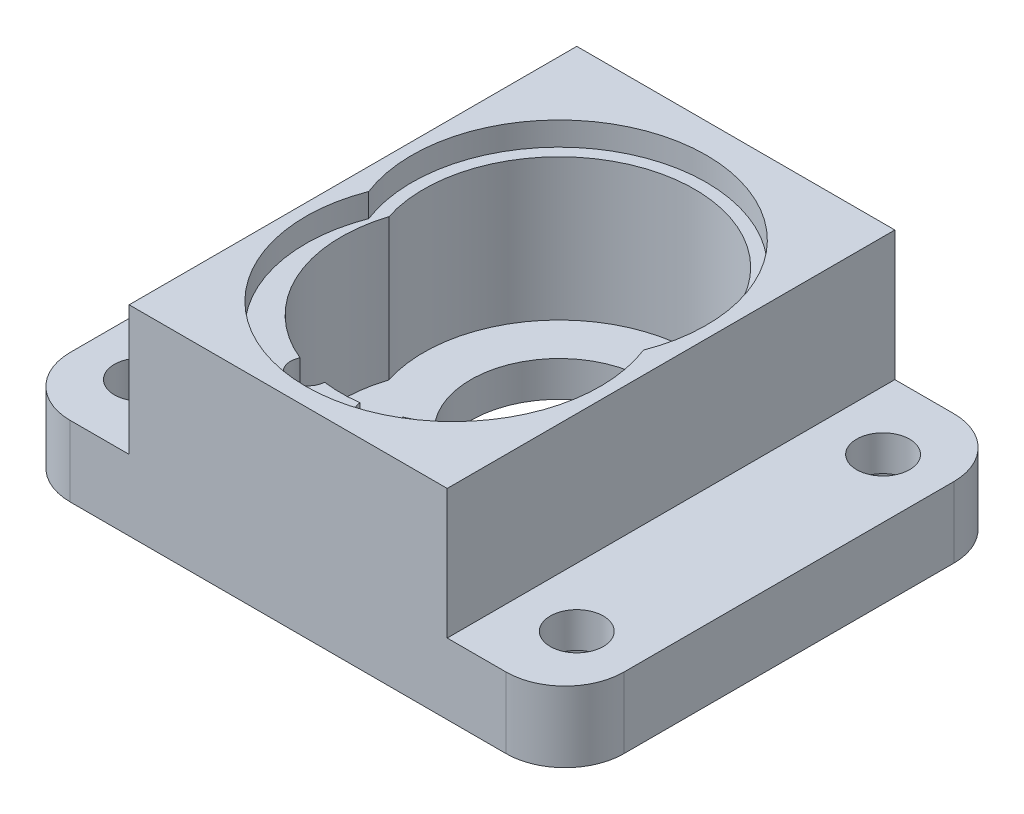
from build123d import *

# Parameters (mm, degrees)
SKETCH_1_W          = 27
SKETCH_1_H          = 38
SKETCH_1_R          = 7.5
SKETCH_1_R_2        = 3.5
SKETCH_1_R_3        = 1.5
EXTRUDE_1_DEPTH     = 3
SKETCH_4_W          = 10
SKETCH_4_H          = 6
EXTRUDE_3_DEPTH     = 38
SKETCH_6_R          = 2.5
CUT_EXTRUDE_3_DEPTH = 1
EXTRUDE_4_OUTLINE_W = 27
EXTRUDE_4_OUTLINE_H = 38
EXTRUDE_4_DEPTH     = 14
SKETCH_13_R         = 2.25
CUT_EXTRUDE_6_DEPTH = 10
CUT_EXTRUDE_8_DEPTH = 2
FILLET_1_R          = 5
SKETCH_17_R         = 4
CUT_EXTRUDE_9_DEPTH = 3


# Read off the part's stored shape, not the designer's step: 凸台-拉伸4
with BuildPart() as part:
    # 草图1 → 凸台-拉伸1 (new body)
    with BuildSketch(Plane(origin=(0, 0, 0), x_dir=(1, 0, 0), z_dir=(0, 1, 0))):
        with Locations((0, 4.3)):
            Rectangle(SKETCH_1_W, SKETCH_1_H)
        with Locations(Location((0, 8.3, 0), (0, 0, 270))):
            Circle(SKETCH_1_R, mode=Mode.SUBTRACT)
        with Locations(Location((0, -5.5, 0), (0, 0, 270))):
            Circle(SKETCH_1_R_2, mode=Mode.SUBTRACT)
        with Locations(Location((-9.5, 0, 0), (0, 0, 90))):
            Circle(SKETCH_1_R_3, mode=Mode.SUBTRACT)
        with Locations(Location((-3, -10, 0), (0, 0, 90))):
            Circle(SKETCH_1_R_3, mode=Mode.SUBTRACT)
        with Locations(Location((9.5, 0, 0), (0, 0, 270))):
            Circle(SKETCH_1_R_3, mode=Mode.SUBTRACT)
        with Locations(Location((3, -10, 0), (0, 0, 270))):
            Circle(SKETCH_1_R_3, mode=Mode.SUBTRACT)
    extrude(amount=EXTRUDE_1_DEPTH)

    # 草图4 → 凸台-拉伸3 (add)
    with BuildSketch(Plane(origin=(0, 0, -23.3), x_dir=(-1, 0, 0), z_dir=(0, 0, -1))):
        with Locations((-18.5, 3)):
            Rectangle(SKETCH_4_W, SKETCH_4_H)
        with Locations((18.5, 3)):
            Rectangle(SKETCH_4_W, SKETCH_4_H)
    extrude(amount=-EXTRUDE_3_DEPTH)

    # 草图6 → 切除-拉伸3 (cut)
    with BuildSketch(Plane.XZ):
        with Locations(Location((-9.5, 0, 0), (0, 0, 270))):
            Circle(SKETCH_6_R)
        with Locations(Location((9.5, 0, 0), (0, 0, 270))):
            Circle(SKETCH_6_R)
    extrude(amount=-CUT_EXTRUDE_3_DEPTH, mode=Mode.SUBTRACT)

    # 凸台-拉伸4 outline → 凸台-拉伸4 (add)
    with BuildSketch(Plane(origin=(0, 3, 0), x_dir=(1, 0, 0), z_dir=(0, 1, 0))):
        with Locations((0, 4.3)):
            Rectangle(EXTRUDE_4_OUTLINE_W, EXTRUDE_4_OUTLINE_H)
        with BuildLine():
            ThreePointArc((-1.503424688, -10.10130318), (-3.38489666, -11.449777418), (-4.349746722, -9.345642463))
            ThreePointArc((-4.349746722, -9.345642463), (-10.420144831, -3.565242203), (-10.95445115, 4.8))
            ThreePointArc((-10.95445115, 4.8), (0, 19.8), (10.95445115, 4.8))
            ThreePointArc((10.95445115, 4.8), (10.420144831, -3.565242203), (4.349746722, -9.345642463))
            ThreePointArc((4.349746722, -9.345642463), (3.38489666, -11.449777418), (1.503424688, -10.10130318))
            ThreePointArc((1.503424688, -10.10130318), (0, -10.2), (-1.503424688, -10.10130318))
        make_face(mode=Mode.SUBTRACT)
    extrude(amount=EXTRUDE_4_DEPTH)

    # 草图13 → 切除-拉伸6 (cut)
    with BuildSketch(Plane(origin=(0, 6, 0), x_dir=(1, 0, 0), z_dir=(0, 1, 0))):
        with Locations(Location((-18.5, 17.3, 0), (0, 0, 180))):
            Circle(SKETCH_13_R)
        with Locations(Location((-18.5, -8.7, 0), (0, 0, 180))):
            Circle(SKETCH_13_R)
        with Locations(Location((18.5, -8.7, 0), (0, 0, 90))):
            Circle(SKETCH_13_R)
        with Locations(Location((18.5, 17.3, 0), (0, 0, 90))):
            Circle(SKETCH_13_R)
    extrude(amount=-CUT_EXTRUDE_6_DEPTH, mode=Mode.SUBTRACT)

    # 草图15 → 切除-拉伸8 (cut)
    with BuildSketch(Plane(origin=(0, 17, 0), x_dir=(1, 0, 0), z_dir=(0, 1, 0))):
        with BuildLine():
            ThreePointArc((11.66190379, 3.8), (0, 20.8), (-11.66190379, 3.8))
            ThreePointArc((-11.66190379, 3.8), (0, -13.2), (11.66190379, 3.8))
        make_face()
    extrude(amount=-CUT_EXTRUDE_8_DEPTH, mode=Mode.SUBTRACT)

    # 圆角1
    fillet_1_edges = [part.edges().sort_by_distance(p)[0] for p in [
        (23.5, 3, -23.3),
        (23.5, 3, 14.7),
        (-23.5, 3, -23.3),
        (-23.5, 3, 14.7),
    ]]
    fillet(fillet_1_edges, radius=FILLET_1_R)

    # 草图17 → 切除-拉伸9 (cut)
    with BuildSketch(Plane.XZ):
        with Locations(Location((-18.5, 8.7, 0), (0, 0, 270))):
            Circle(SKETCH_17_R)
        with Locations(Location((18.5, 8.7, 0), (0, 0, 270))):
            Circle(SKETCH_17_R)
        with Locations(Location((18.5, -17.3, 0), (0, 0, 270))):
            Circle(SKETCH_17_R)
        with Locations(Location((-18.5, -17.3, 0), (0, 0, 270))):
            Circle(SKETCH_17_R)
    extrude(amount=-CUT_EXTRUDE_9_DEPTH, mode=Mode.SUBTRACT)


solid = part.part
